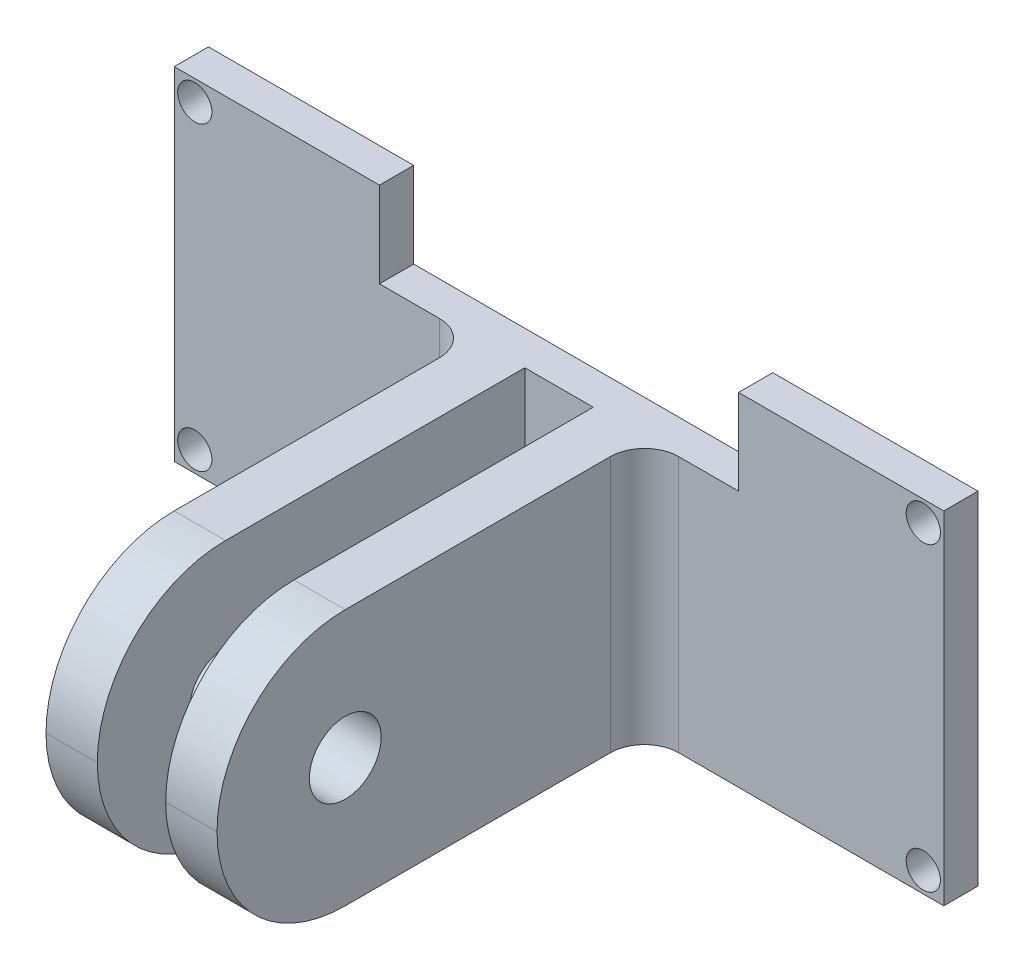
from build123d import *

# Parameters (mm, degrees)
SKETCH_1_R          = 1
EXTRUDE_1_DEPTH     = 2
SKETCH_2_W          = 3
SKETCH_2_H          = 15
EXTRUDE_2_DEPTH     = 25
FILLET_1_R          = 7.5
SKETCH_3_R          = 2.1
CUT_EXTRUDE_1_DEPTH = 15
FILLET_2_R          = 2


with BuildPart() as part:
    # 草图1 → 凸台-拉伸1 (new body)
    with BuildSketch(Plane.XY):
        Polygon((1.466666667, 10.933333333), (13.466666667, 10.933333333), (13.466666667, -9.066666667), (-31.533333333, -9.066666667), (-31.533333333, 10.933333333), (-19.533333333, 10.933333333), (-19.533333333, 5.933333333), (1.466666667, 5.933333333), align=None)
        with Locations((-30.333333333, 9.733333333)):
            Circle(SKETCH_1_R, mode=Mode.SUBTRACT)
        with Locations((-30.333333333, -7.866666667)):
            Circle(SKETCH_1_R, mode=Mode.SUBTRACT)
        with Locations((12.266666667, 9.733333333)):
            Circle(SKETCH_1_R, mode=Mode.SUBTRACT)
        with Locations((12.266666667, -7.866666667)):
            Circle(SKETCH_1_R, mode=Mode.SUBTRACT)
    extrude(amount=EXTRUDE_1_DEPTH)

    # 草图2 → 凸台-拉伸2 (add)
    with BuildSketch(Plane.XY.offset(2)):
        with Locations((-12.533333333, -1.566666667)):
            Rectangle(SKETCH_2_W, SKETCH_2_H)
        with Locations((-5.533333333, -1.566666667)):
            Rectangle(SKETCH_2_W, SKETCH_2_H)
    extrude(amount=EXTRUDE_2_DEPTH)

    # 圆角1
    fillet_1_edges = [part.edges().sort_by_distance(p)[0] for p in [
        (-5.533333333, -9.066666667, 27),
        (-12.533333333, -9.066666667, 27),
        (-5.533333333, 5.933333333, 27),
        (-12.533333333, 5.933333333, 27),
    ]]
    fillet(fillet_1_edges, radius=FILLET_1_R - 0.0001)  # a hair under: the kernel refuses the full size

    # 草图3 → 切除-拉伸1 (cut)
    with BuildSketch(Plane(origin=(-4.033333333, 0, 0), x_dir=(0, 0, -1), z_dir=(1, 0, 0))):
        with Locations(Location((-19.5, -1.566666667, 0), (0, 0, 90))):
            Circle(SKETCH_3_R)
    extrude(amount=-CUT_EXTRUDE_1_DEPTH, mode=Mode.SUBTRACT)

    # 圆角2
    fillet_2_edges = [part.edges().sort_by_distance(p)[0] for p in [
        (-14.033333333, -1.566666667, 2),
        (-4.033333333, -1.566666667, 2),
    ]]
    fillet(fillet_2_edges, radius=FILLET_2_R)


solid = part.part
